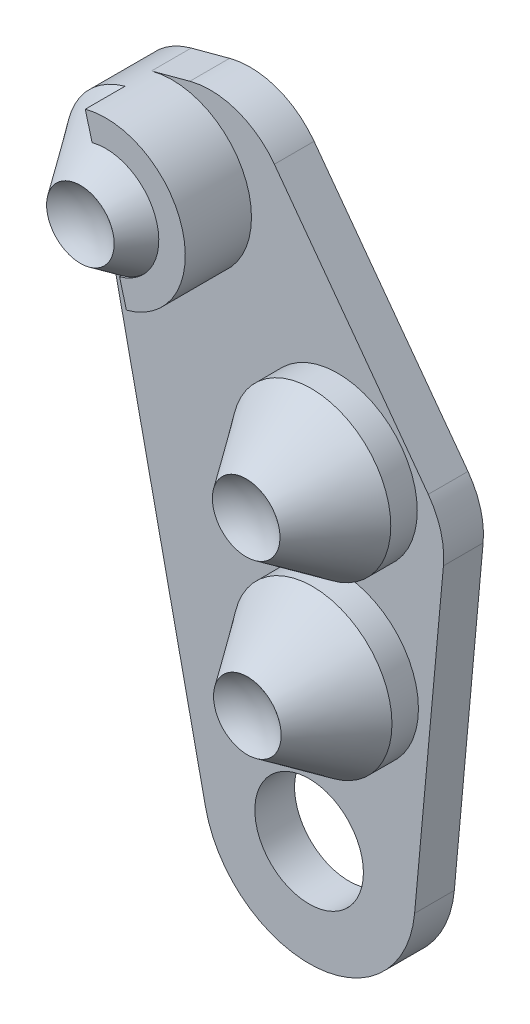
from build123d import *
from build123d.topology import SkipClean

# Parameters (mm, degrees)
BOSS_EXTRUDE1_DEPTH = 3
SKETCH3_R           = 4.1
CUT_EXTRUDE1_DEPTH  = 50
SKETCH1_3_R         = 6
BOSS_EXTRUDE2_DEPTH = 10
SKETCH1_4_R         = 6
BOSS_EXTRUDE3_DEPTH = 10
SKETCH1_5_R         = 6
BOSS_EXTRUDE8_DEPTH = 10
CHAMFER8_SIZE       = 5
CHAMFER8_SIZE_2     = 3.501037691
BOSS_EXTRUDE7_START = 1.9999999
BOSS_EXTRUDE7_DEPTH = 3.0000001


# Read off the part's stored shape, not the designer's step: Boss-Extrude7
with BuildPart() as part:
    # Sketch1 → Boss-Extrude1 (new body)
    with BuildSketch(Plane.XY):
        with BuildLine():
            ThreePointArc((-7.821268925, -1.68159222), (0.48240993, -7.985441795), (7.966824047, -0.727814955))
            Line((7.966824047, -0.727814955), (10.142674299, 23.089524856))
            ThreePointArc((10.142674299, 23.089524856), (9.947144202, 25.246709523), (8.998392886, 27.19389946))
            Line((8.998392886, 27.19389946), (-2.624147703, 42.972003574))
            ThreePointArc((-2.624147703, 42.972003574), (-5.470725652, 45.075885221), (-9.007898596, 45.209045145))
            Line((-9.007898596, 45.209045145), (-11.905676075, 44.432588009))
            ThreePointArc((-11.905676075, 44.432588009), (-15.472265696, 41.766039268), (-16.218713498, 37.375838886))
            Line((-16.218713498, 37.375838886), (-7.821268925, -1.68159222))
        make_face()
    extrude(amount=BOSS_EXTRUDE1_DEPTH)

    # Sketch3 → Cut-Extrude1 (cut)
    with BuildSketch(Plane.XY.offset(3)):
        Circle(SKETCH3_R)
    extrude(amount=-CUT_EXTRUDE1_DEPTH, mode=Mode.SUBTRACT)

    # Sketch1<3> → Boss-Extrude2 (add)
    with BuildSketch(Plane.XY):
        with Locations(Location((-10.352761804, 38.637033052, 0), (0, 0, 192.134016017))):
            Circle(SKETCH1_3_R)
    extrude(amount=BOSS_EXTRUDE2_DEPTH)

    # Sketch1<4> → Boss-Extrude3 (add)
    with BuildSketch(Plane.XY):
        with Locations((2.167556264, 25.701683368)):
            Circle(SKETCH1_4_R)
    extrude(amount=BOSS_EXTRUDE3_DEPTH)

    # Sketch1<5> → Boss-Extrude8 (add)
    with BuildSketch(Plane.XY):
        with Locations((2.25742631, 12.802500789)):
            Circle(SKETCH1_5_R)
    extrude(amount=BOSS_EXTRUDE8_DEPTH)

    # Sketch6 one side → Cut-Revolve1 (revolve, cut)
    with SkipClean():  # the faces are left unmerged after this step: merging them gives an invalid solid
        with BuildSketch(Plane(origin=(-10.352761804, 0, 0), x_dir=(0, 0, -1), z_dir=(1, 0, 0))):
            with BuildLine():
                ThreePointArc((-13, 34.637033052), (-10.171572875, 35.808605927), (-9, 38.637033052))
                ThreePointArc((-9, 38.637033052), (-10.171572875, 41.465460176), (-13, 42.637033052))
                Line((-13, 42.637033052), (-13, 34.637033052))
            make_face()
        revolve(axis=Axis((-10.352761804, 42.637033052, 13), (0, -1, 0)), mode=Mode.SUBTRACT)

    # Sketch7 one side → Cut-Revolve2 (revolve, cut)
    with SkipClean():  # the faces are left unmerged after this step: merging them gives an invalid solid
        with BuildSketch(Plane(origin=(2.167556264, 0, 0), x_dir=(0, 0, -1), z_dir=(1, 0, 0))):
            with BuildLine():
                ThreePointArc((-13, 21.701683368), (-10.171572875, 22.873256243), (-9, 25.701683368))
                ThreePointArc((-9, 25.701683368), (-10.171572875, 28.530110493), (-13, 29.701683368))
                Line((-13, 29.701683368), (-13, 21.701683368))
            make_face()
        revolve(axis=Axis((2.167556264, 29.701683368, 13), (0, -1, 0)), mode=Mode.SUBTRACT)

    # Sketch16 → Cut-Revolve3 (revolve, cut)
    with SkipClean():  # the faces are left unmerged after this step: merging them gives an invalid solid
        with BuildSketch(Plane(origin=(2.25742631, 0, 0), x_dir=(0, 0, -1), z_dir=(1, 0, 0))):
            with BuildLine():
                ThreePointArc((-9, 12.802500789), (-10.171572875, 15.630927914), (-13, 16.802500789))
                Line((-13, 16.802500789), (-13, 8.802500789))
                ThreePointArc((-13, 8.802500789), (-10.171572875, 9.974073664), (-9, 12.802500789))
            make_face()
            with BuildLine():
                Line((-13, 8.802500789), (-13, 16.802500789))
                ThreePointArc((-13, 16.802500789), (-17, 12.802500789), (-13, 8.802500789))
            make_face()
        revolve(axis=Axis((2.25742631, 16.802500789, 13), (0, -1, 0)), mode=Mode.SUBTRACT)

    # Chamfer8
    # the kernel refuses this chamfer: 5, 3.501037691 mm, written as the material it takes off along each edge
    with BuildSketch(Plane(origin=(-10.352761804, 38.637033052, 10), x_dir=(-0.9776586156884893, -0.21019902751931718, 0), z_dir=(-0.21019902751931718, 0.9776586156884893, 0))) as chamfer8_piece_1:
        Polygon((6, -CHAMFER8_SIZE), (6 - CHAMFER8_SIZE_2, 0), (6, 0), align=None)
    revolve(axis=Axis((-10.352761804, 38.637033052, 10), (0, 0, 1)), mode=Mode.SUBTRACT)
    with BuildSketch(Plane(origin=(2.167556264, 25.701683368, 10), x_dir=(1, 0, 0), z_dir=(0, -1, 0))) as chamfer8_piece_2:
        Polygon((6, -CHAMFER8_SIZE), (6 - CHAMFER8_SIZE_2, 0), (6, 0), align=None)
    revolve(axis=Axis((2.167556264, 25.701683368, 10), (0, 0, 1)), mode=Mode.SUBTRACT)
    with BuildSketch(Plane(origin=(2.25742631, 12.802500789, 10), x_dir=(1, 0, 0), z_dir=(0, -1, 0))) as chamfer8_piece_3:
        Polygon((6, -CHAMFER8_SIZE), (6 - CHAMFER8_SIZE_2, 0), (6, 0), align=None)
    revolve(axis=Axis((2.25742631, 12.802500789, 10), (0, 0, 1)), mode=Mode.SUBTRACT)

    # Boss-Extrude7 outline → Boss-Extrude7 (add)
    with BuildSketch(Plane.XY.offset(3).offset(BOSS_EXTRUDE7_START)):
        with BuildLine():
            ThreePointArc((-8.799847533, 32.841478094), (-4.557206846, 40.189947323), (-11.905676075, 44.43258801))
            Line((-11.905676075, 44.43258801), (-11.388037985, 42.500736357))
            ThreePointArc((-11.388037985, 42.500736357), (-6.489058499, 39.672309232), (-9.317485624, 34.773329746))
            Line((-9.317485624, 34.773329746), (-8.799847533, 32.841478094))
        make_face()
    extrude(amount=BOSS_EXTRUDE7_DEPTH)


solid = part.part
